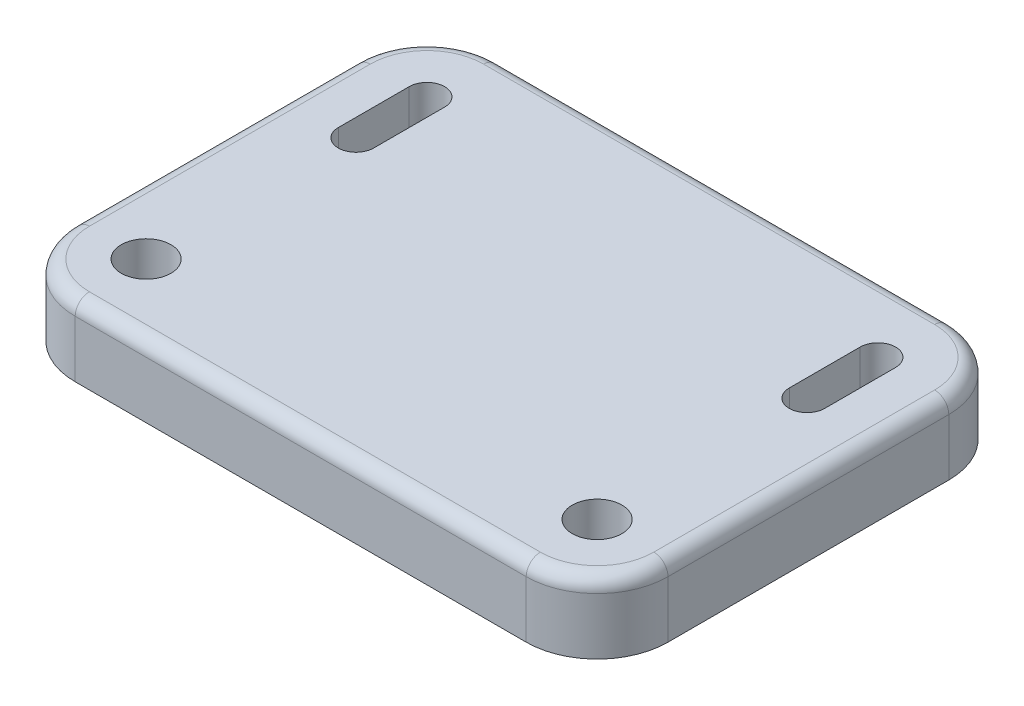
from build123d import *

# Parameters (mm, degrees)
SKETCH1_W           = 41.8
SKETCH1_H           = 29.8
SKETCH1_R           = 1.75
BOSS_EXTRUDE1_DEPTH = 5
FILLET1_R           = 5
FILLET2_R           = 1


with BuildPart() as part:
    # Sketch1 → Boss-Extrude1 (new body)
    with BuildSketch(Plane(origin=(0, 0, 0), x_dir=(1, 0, 0), z_dir=(0, 1, 0))):
        with Locations((20.9, 14.9)):
            Rectangle(SKETCH1_W, SKETCH1_H)
        with Locations((5, 5)):
            Circle(SKETCH1_R, mode=Mode.SUBTRACT)
        with Locations((36.8, 5)):
            Circle(SKETCH1_R, mode=Mode.SUBTRACT)
        with BuildLine():
            Line((3.75, 19.8), (3.75, 24.8))
            ThreePointArc((3.75, 24.8), (5, 26.05), (6.25, 24.8))
            Line((6.25, 24.8), (6.25, 19.8))
            ThreePointArc((6.25, 19.8), (5, 18.55), (3.75, 19.8))
        make_face(mode=Mode.SUBTRACT)
        with BuildLine():
            Line((35.55, 19.8), (35.55, 24.8))
            ThreePointArc((35.55, 24.8), (36.8, 26.05), (38.05, 24.8))
            Line((38.05, 24.8), (38.05, 19.8))
            ThreePointArc((38.05, 19.8), (36.8, 18.55), (35.55, 19.8))
        make_face(mode=Mode.SUBTRACT)
    extrude(amount=BOSS_EXTRUDE1_DEPTH)

    # Fillet1
    fillet1_edges = [part.edges().sort_by_distance(p)[0] for p in [
        (0, 2.5, -29.8),
        (41.8, 2.5, -29.8),
        (41.8, 2.5, 0),
        (0, 2.5, 0),
    ]]
    fillet(fillet1_edges, radius=FILLET1_R)

    # Fillet2
    fillet2_edges = [part.edges().sort_by_distance(p)[0] for p in [
        (1.464466094, 5, -1.464466094),
        (0, 5, -14.9),
        (1.464466094, 5, -28.335533906),
        (20.9, 5, -29.8),
        (40.335533906, 5, -28.335533906),
        (41.8, 5, -14.9),
        (40.335533906, 5, -1.464466094),
        (20.9, 5, 0),
    ]]
    fillet(fillet2_edges, radius=FILLET2_R)


solid = part.part
